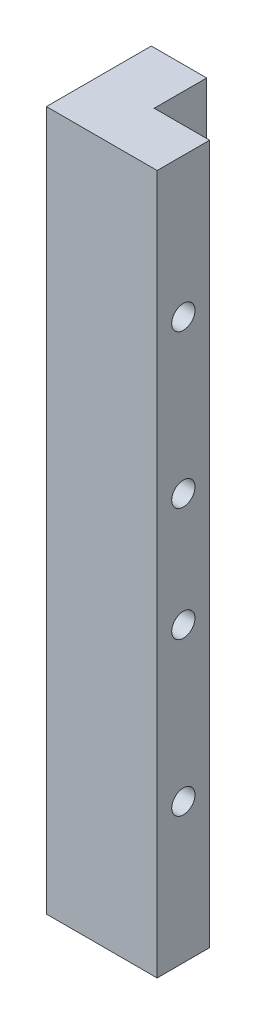
from build123d import *

# Parameters (mm, degrees)
BOSS_EXTRUDE1_DEPTH = 120
SKETCH2_R           = 2
CUT_EXTRUDE1_DEPTH  = 19


with BuildPart() as part:
    # Sketch1 → Boss-Extrude1 (new body)
    with BuildSketch(Plane(origin=(0, 0, 0), x_dir=(1, 0, 0), z_dir=(0, 1, 0))):
        Polygon((-9.5, -4.5), (9.5, -4.5), (9.5, 4.5), (0, 4.5), (0, 13.5), (-9.5, 13.5), align=None)
    extrude(amount=BOSS_EXTRUDE1_DEPTH)

    # Sketch2 → Cut-Extrude1 (cut)
    with BuildSketch(Plane(origin=(9.5, 0, -9.5), x_dir=(0, 0, 1), z_dir=(-1, 0, 0))):
        with Locations((9.5, 24)):
            Circle(SKETCH2_R)
        with Locations((9.5, 50.25)):
            Circle(SKETCH2_R)
        with Locations((9.5, 69.75)):
            Circle(SKETCH2_R)
        with Locations((9.5, 96)):
            Circle(SKETCH2_R)
    extrude(amount=CUT_EXTRUDE1_DEPTH, mode=Mode.SUBTRACT)


solid = part.part
